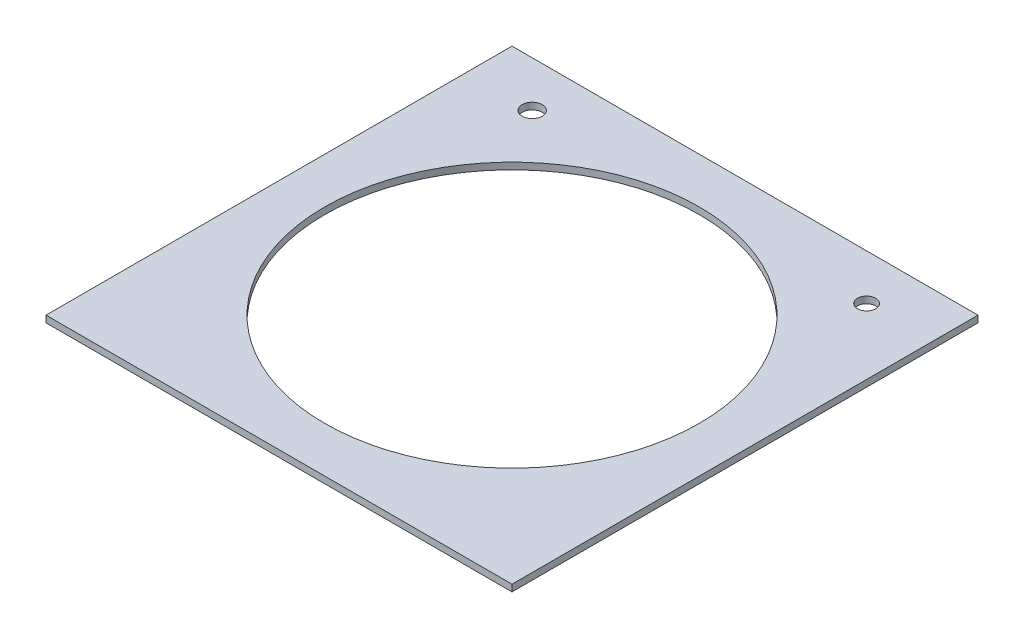
from build123d import *

# Parameters (mm, degrees)
SKETCH1_W           = 69.669199876
SKETCH1_H           = 69.669199876
SKETCH1_R           = 1.5
SKETCH1_R_2         = 1.363636364
SKETCH1_R_3         = 28.016418119
BOSS_EXTRUDE1_DEPTH = 1


with BuildPart() as part:
    # Sketch1 → Boss-Extrude1 (new body)
    with BuildSketch(Plane(origin=(0, 0, 0), x_dir=(1, 0, 0), z_dir=(0, 1, 0))):
        Rectangle(SKETCH1_W, SKETCH1_H)
        with Locations((-25, 28.016418119)):
            Circle(SKETCH1_R, mode=Mode.SUBTRACT)
        with Locations((25, 28.016418119)):
            Circle(SKETCH1_R_2, mode=Mode.SUBTRACT)
        Circle(SKETCH1_R_3, mode=Mode.SUBTRACT)
    extrude(amount=BOSS_EXTRUDE1_DEPTH)


solid = part.part
